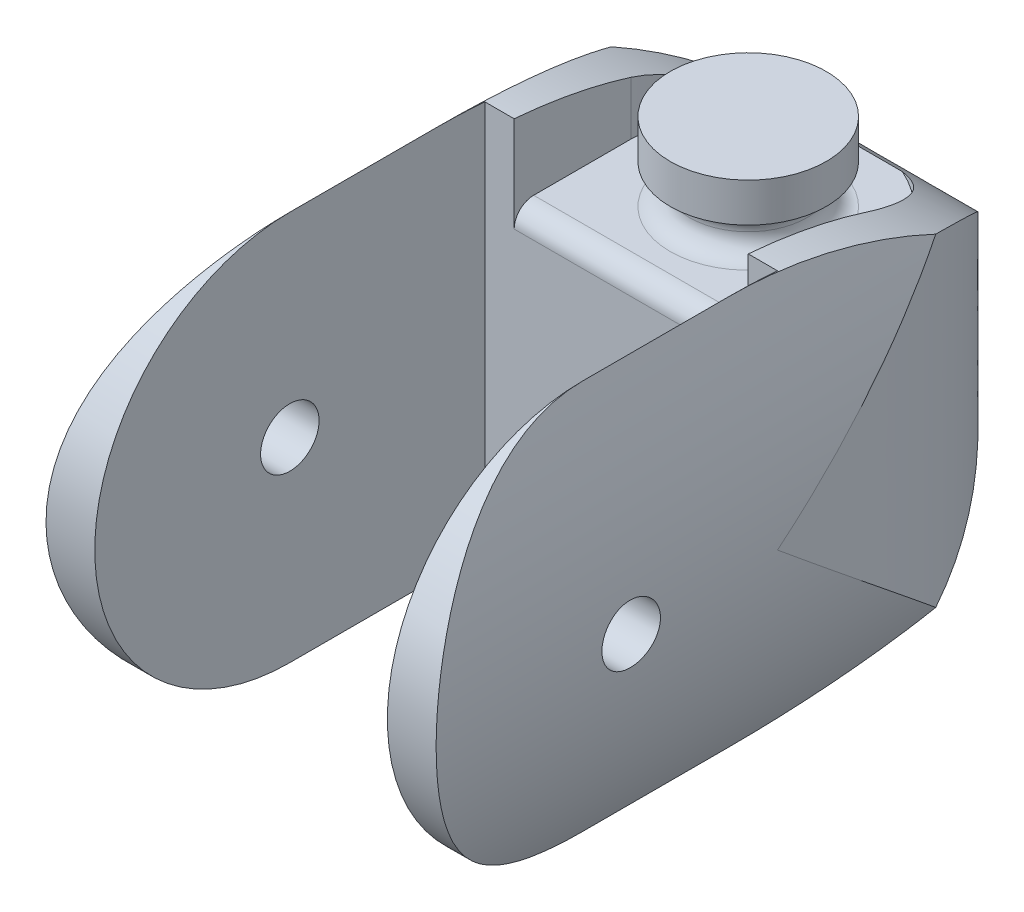
from build123d import *

# Parameters (mm, degrees)
SALIENTE_EXTRUIR1_DEPTH    = 35
CROQUIS3_R                 = 1.5
CORTAR_EXTRUIR2_DEPTH      = 38.749172176
CROQUIS6_W                 = 15
CROQUIS6_H                 = 20
CORTAR_EXTRUIR4_DEPTH      = 20
CORTAR_EXTRUIR5_DEPTH      = 38.749172176
CORTAR_EXTRUIR5_DEPTH_BACK = 38.749172176
CROQUIS7_R                 = 1.5
CORTAR_EXTRUIR1_DEPTH      = 38.749172328
CORTAR_EXTRUIR1_DEPTH_BACK = 38.749172328
CORTAR_EXTRUIR3_DEPTH      = 38.749172461
CORTAR_EXTRUIR3_DEPTH_BACK = 38.749172461
CUT_EXTRUDE1_DEPTH         = 4
SKETCH2_R                  = 3
BOSS_EXTRUDE1_DEPTH        = 2
SKETCH3_R                  = 4
BOSS_EXTRUDE2_DEPTH        = 2
FILLET1_R                  = 1
FILLET2_R                  = 1
FILLET4_R                  = 1


with BuildPart() as part:
    # Croquis1 → Saliente-Extruir1 (new body)
    with BuildSketch(Plane.XY):
        with BuildLine():
            Line((-7.5, 10), (7.5, 10))
            ThreePointArc((7.5, 10), (10, 0), (7.5, -10))
            Line((7.5, -10), (-7.5, -10))
            ThreePointArc((-7.5, -10), (-10, 0), (-7.5, 10))
        make_face()
    extrude(amount=SALIENTE_EXTRUIR1_DEPTH)

    # Croquis3 → Cortar-Extruir2 (cut, through all)
    with BuildSketch(Plane.XY.offset(35)):
        with Locations((0, -7)):
            Circle(CROQUIS3_R)
    extrude(amount=-CORTAR_EXTRUIR2_DEPTH, mode=Mode.SUBTRACT)

    # Croquis6 → Cortar-Extruir4 (cut)
    with BuildSketch(Plane.XY.offset(35)):
        Rectangle(CROQUIS6_W, CROQUIS6_H)
    extrude(amount=-CORTAR_EXTRUIR4_DEPTH, mode=Mode.SUBTRACT)

    # Croquis7 → Cortar-Extruir5 (cut, two sides: drawn at the far end of the back side and taken through both)
    with BuildSketch(Plane(origin=(0, 0, 0), x_dir=(0, 0, -1), z_dir=(1, 0, 0)).offset(-CORTAR_EXTRUIR5_DEPTH_BACK)):
        with Locations((-25, 0)):
            Circle(CROQUIS7_R)
        with BuildLine():
            Line((-25, -10), (-41, -10))
            Line((-41, -10), (-41, 10))
            Line((-41, 10), (-25, 10))
            ThreePointArc((-25, 10), (-35, 0), (-25, -10))
        make_face()
    extrude(amount=CORTAR_EXTRUIR5_DEPTH + CORTAR_EXTRUIR5_DEPTH_BACK, mode=Mode.SUBTRACT)

    # Croquis2 → Cortar-Extruir1 (cut, two sides: drawn at the far end of the back side and taken through both)
    with BuildSketch(Plane(origin=(0, 0, 0), x_dir=(1, 0, 0), z_dir=(0, 1, 0)).offset(-CORTAR_EXTRUIR1_DEPTH_BACK)):
        with BuildLine():
            Line((-1.261783996, 0), (1.261783996, 0))
            add(Edge.make_bspline(
                [(10, -17.5), (10, -1.960721315), (1.261783996, 0)],
                knots=[4.71238898, 4.71238898, 4.71238898, 6.156669672, 6.156669672, 6.156669672], degree=2, weights=[1, 0.750392697, 1]))
            Line((10, -17.5), (10, 3.270111557))
            Line((10, 3.270111557), (-10, 3.270111557))
            Line((-10, 3.270111557), (-10, -17.5))
            add(Edge.make_bspline(
                [(-1.261783996, 0), (-10, -1.960721315), (-10, -17.5)],
                knots=[0.126515635, 0.126515635, 0.126515635, 1.570796327, 1.570796327, 1.570796327], degree=2, weights=[1, 0.750392697, 1]))
        make_face()
    extrude(amount=CORTAR_EXTRUIR1_DEPTH + CORTAR_EXTRUIR1_DEPTH_BACK, mode=Mode.SUBTRACT)

    # Croquis5 → Cortar-Extruir3 (cut, two sides: drawn at the far end of the back side and taken through both)
    with BuildSketch(Plane(origin=(0, 0, 0), x_dir=(0, 0, -1), z_dir=(1, 0, 0)).offset(-CORTAR_EXTRUIR3_DEPTH_BACK)):
        with BuildLine():
            Line((-17.5, -10), (6.249957369, -10))
            Line((6.249957369, -10), (6.249957369, 10))
            Line((6.249957369, 10), (-17.5, 10))
            add(Edge.make_bspline(
                [(-17.5, -10), (0, -10), (0, 0), (0, 10), (-17.5, 10)],
                knots=[4.71238898, 4.71238898, 4.71238898, 6.283185307, 6.283185307, 7.853981634, 7.853981634, 7.853981634], degree=2, weights=[1, 0.707106781, 1, 0.707106781, 1]))
        make_face()
    extrude(amount=CORTAR_EXTRUIR3_DEPTH + CORTAR_EXTRUIR3_DEPTH_BACK, mode=Mode.SUBTRACT)

    # Sketch1 → Cut-Extrude1 (cut)
    with BuildSketch(Plane(origin=(0, 10, 0), x_dir=(1, 0, 0), z_dir=(0, 1, 0))):
        with BuildLine():
            Line((-6, -9), (-6, -15))
            Line((-6, -15), (6, -15))
            Line((6, -15), (6, -9))
            ThreePointArc((6, -9), (0, -3), (-6, -9))
        make_face()
    extrude(amount=-CUT_EXTRUDE1_DEPTH, mode=Mode.SUBTRACT)

    # Sketch2 → Boss-Extrude1 (add)
    with BuildSketch(Plane(origin=(0, 6, 0), x_dir=(1, 0, 0), z_dir=(0, 1, 0))):
        with Locations(Location((0, -9, 0), (0, 0, 270))):
            Circle(SKETCH2_R)
    extrude(amount=BOSS_EXTRUDE1_DEPTH)

    # Sketch3 → Boss-Extrude2 (add)
    with BuildSketch(Plane(origin=(0, 8, 0), x_dir=(1, 0, 0), z_dir=(0, 1, 0))):
        with Locations(Location((0, -9, 0), (0, 0, 270))):
            Circle(SKETCH3_R)
    extrude(amount=BOSS_EXTRUDE2_DEPTH)

    # Fillet1
    fillet1_edges = [part.edges().sort_by_distance(p)[0] for p in [
        (0, 6, 6),
        (0, 8, 6),
    ]]
    fillet(fillet1_edges, radius=FILLET1_R - 0.0001)  # a hair under: the kernel refuses the full size

    # Fillet2
    fillet2_edges = [part.edges().sort_by_distance(p)[0] for p in [
        (0, 6, 15),
    ]]
    fillet(fillet2_edges, radius=FILLET2_R)

    # Fillet4
    fillet4_edges = [part.edges().sort_by_distance(p)[0] for p in [
        (-1.5, -7, 15),
    ]]
    fillet(fillet4_edges, radius=FILLET4_R)


solid = part.part
